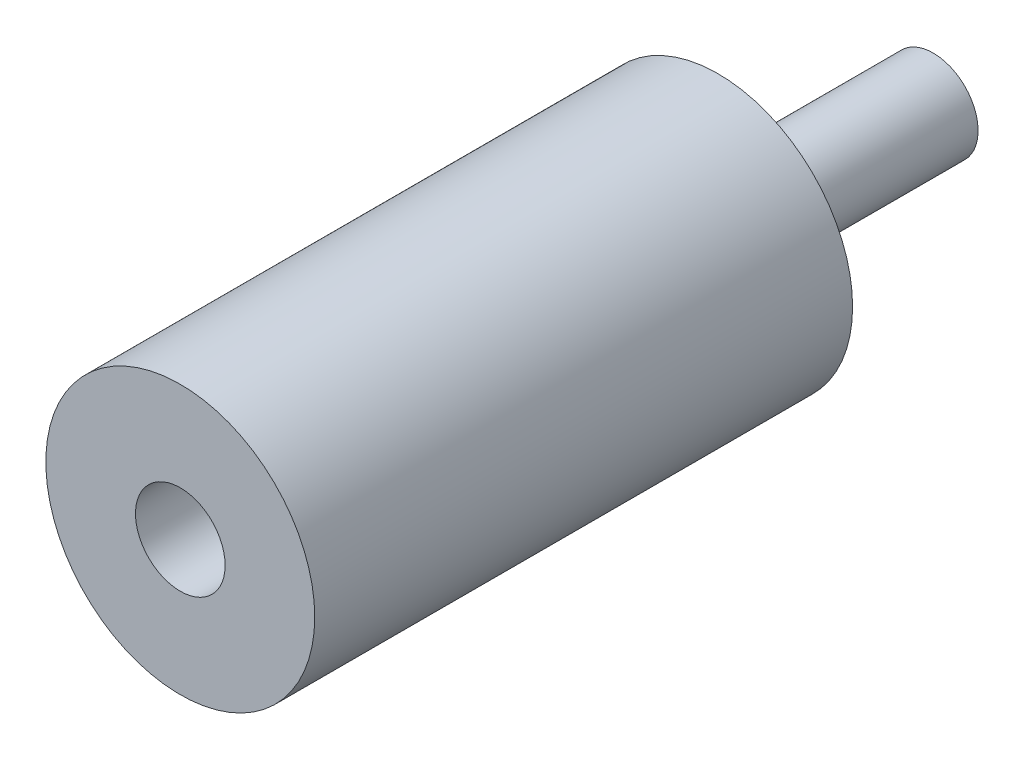
from build123d import *

# Parameters (mm, degrees)
SKETCH_1_R          = 7.5
EXTRUDE_1_DEPTH     = 30
SKETCH_2_R          = 2.5
EXTRUDE_2_DEPTH     = 12
SKETCH_3_R          = 2.5
CUT_EXTRUDE_1_DEPTH = 5


with BuildPart() as part:
    # 草图1 → 凸台-拉伸1 (new body)
    with BuildSketch(Plane.XY):
        Circle(SKETCH_1_R)
    extrude(amount=EXTRUDE_1_DEPTH)

    # 草图2 → 凸台-拉伸2 (add)
    with BuildSketch(Plane(origin=(0, 0, 0), x_dir=(-1, 0, 0), z_dir=(0, 0, -1))):
        Circle(SKETCH_2_R)
    extrude(amount=EXTRUDE_2_DEPTH)

    # 草图3 → 切除-拉伸1 (cut)
    with BuildSketch(Plane.XY.offset(30)):
        Circle(SKETCH_3_R)
    extrude(amount=-CUT_EXTRUDE_1_DEPTH, mode=Mode.SUBTRACT)


solid = part.part
